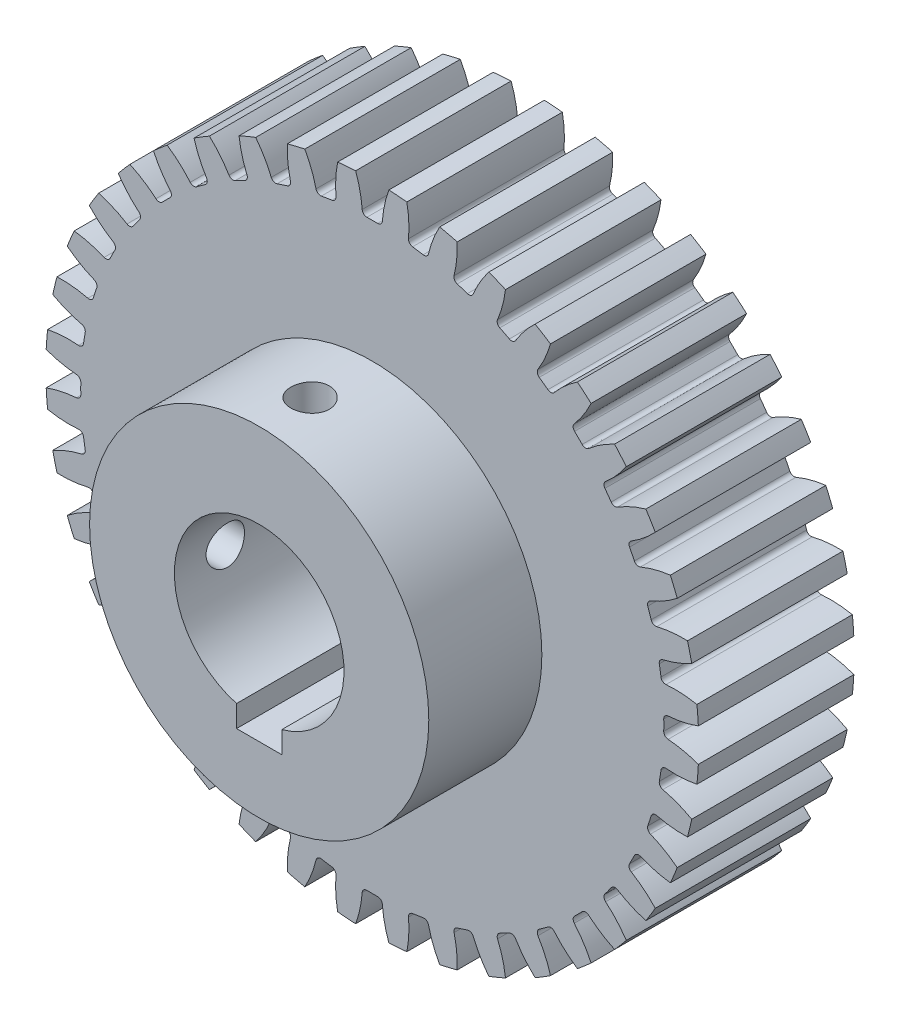
from build123d import *

# Parameters (mm, degrees)
SKETCH1_R                = 57.75
BOSS_EXTRUDE1_DEPTH      = 13.75
CUT_EXTRUDE1_DEPTH       = 27.5
FILLET1_R                = 0.825
CIRPATTERN1_COUNT        = 40
FILLET1_OF_CIRPATTERN1_R = 0.825
SKETCH3_R                = 30
BOSS_EXTRUDE2_DEPTH      = 20
SKETCH4_R                = 15
CUT_EXTRUDE2_DEPTH       = 95.387950609
CIRPATTERN2_COUNT        = 2
CIRPATTERN2_ANGLE        = 90
SKETCH7_W                = 8
SKETCH7_H                = 47.5
CUT_EXTRUDE3_DEPTH       = 18.3


with BuildPart() as part:
    # Sketch1 → Boss-Extrude1 (new, symmetric)
    with BuildSketch(Plane.XY):
        Circle(SKETCH1_R)
    extrude(amount=BOSS_EXTRUDE1_DEPTH, both=True)

    # Sketch2 → Cut-Extrude1 (cut)
    with BuildSketch(Plane.XY.offset(13.75)):
        with BuildLine():
            ThreePointArc((1.742642839, 51.533043789), (0, 51.5625), (-1.742642839, 51.533043789))
            ThreePointArc((-1.742642839, 51.533043789), (-2.159289867, 54.957596993), (-3.164274513, 58.257773542))
            ThreePointArc((-3.164274513, 58.257773542), (0, 58.343644138), (3.164274513, 58.257773542))
            ThreePointArc((3.164274513, 58.257773542), (2.159289867, 54.957596993), (1.742642839, 51.533043789))
        make_face()
    cut_extrude1 = extrude(amount=-CUT_EXTRUDE1_DEPTH, mode=Mode.SUBTRACT)

    # Fillet1
    fillet1_edges = [part.edges().sort_by_distance(p)[0] for p in [
        (1.742642839, 51.533043789, 0),
        (-1.742642839, 51.533043789, 0),
    ]]
    fillet(fillet1_edges, radius=FILLET1_R)

    # CirPattern1: Cut-Extrude1 ×40 about axis
    cirpattern1_axis = Axis((0, 0, 13.75), (0, 0, 1))
    for i in range(1, CIRPATTERN1_COUNT):
        add(cut_extrude1.rotate(cirpattern1_axis, i * 360 / CIRPATTERN1_COUNT), mode=Mode.SUBTRACT)

    # Fillet1 of CirPattern1
    fillet1_of_cirpattern1_edges = [part.edges().sort_by_distance(p)[0] for p in [
        (-6.340356123, 51.171195906, 0),
        (-9.782732151, 50.625977106, 0),
        (-14.267234475, 49.549343353, 0),
        (-17.581938131, 48.472330848, 0),
        (-21.842806164, 46.707421521, 0),
        (-24.948218442, 45.125134934, 0),
        (-28.880535473, 42.715407958, 0),
        (-31.700190817, 40.666808436, 0),
        (-35.20713015, 37.671599287, 0),
        (-37.671599287, 35.20713015, 0),
        (-40.666808436, 31.700190817, 0),
        (-42.715407958, 28.880535473, 0),
        (-45.125134934, 24.948218442, 0),
        (-46.707421521, 21.842806164, 0),
        (-48.472330848, 17.581938131, 0),
        (-49.549343353, 14.267234475, 0),
        (-50.625977106, 9.782732151, 0),
        (-51.171195906, 6.340356123, 0),
        (-51.533043789, 1.742642839, 0),
        (-51.533043789, -1.742642839, 0),
        (-51.171195906, -6.340356123, 0),
        (-50.625977106, -9.782732151, 0),
        (-49.549343353, -14.267234475, 0),
        (-48.472330848, -17.581938131, 0),
        (-46.707421521, -21.842806164, 0),
        (-45.125134934, -24.948218442, 0),
        (-42.715407958, -28.880535473, 0),
        (-40.666808436, -31.700190817, 0),
        (-37.671599287, -35.20713015, 0),
        (-35.20713015, -37.671599287, 0),
        (-31.700190817, -40.666808436, 0),
        (-28.880535473, -42.715407958, 0),
        (-24.948218442, -45.125134934, 0),
        (-21.842806164, -46.707421521, 0),
        (-17.581938131, -48.472330848, 0),
        (-14.267234475, -49.549343353, 0),
        (-9.782732151, -50.625977106, 0),
        (-6.340356123, -51.171195906, 0),
        (-1.742642839, -51.533043789, 0),
        (1.742642839, -51.533043789, 0),
        (6.340356123, -51.171195906, 0),
        (9.782732151, -50.625977106, 0),
        (14.267234475, -49.549343353, 0),
        (17.581938131, -48.472330848, 0),
        (21.842806164, -46.707421521, 0),
        (24.948218442, -45.125134934, 0),
        (28.880535473, -42.715407958, 0),
        (31.700190817, -40.666808436, 0),
        (35.20713015, -37.671599287, 0),
        (37.671599287, -35.20713015, 0),
        (40.666808436, -31.700190817, 0),
        (42.715407958, -28.880535473, 0),
        (45.125134934, -24.948218442, 0),
        (46.707421521, -21.842806164, 0),
        (48.472330848, -17.581938131, 0),
        (49.549343353, -14.267234475, 0),
        (50.625977106, -9.782732151, 0),
        (51.171195906, -6.340356123, 0),
        (51.533043789, -1.742642839, 0),
        (51.533043789, 1.742642839, 0),
        (51.171195906, 6.340356123, 0),
        (50.625977106, 9.782732151, 0),
        (49.549343353, 14.267234475, 0),
        (48.472330848, 17.581938131, 0),
        (46.707421521, 21.842806164, 0),
        (45.125134934, 24.948218442, 0),
        (42.715407958, 28.880535473, 0),
        (40.666808436, 31.700190817, 0),
        (37.671599287, 35.20713015, 0),
        (35.20713015, 37.671599287, 0),
        (31.700190817, 40.666808436, 0),
        (28.880535473, 42.715407958, 0),
        (24.948218442, 45.125134934, 0),
        (21.842806164, 46.707421521, 0),
        (17.581938131, 48.472330848, 0),
        (14.267234475, 49.549343353, 0),
        (9.782732151, 50.625977106, 0),
        (6.340356123, 51.171195906, 0),
    ]]
    fillet(fillet1_of_cirpattern1_edges, radius=FILLET1_OF_CIRPATTERN1_R)

    # Sketch3 → Boss-Extrude2 (add)
    with BuildSketch(Plane.XY.offset(13.75)):
        Circle(SKETCH3_R)
    extrude(amount=BOSS_EXTRUDE2_DEPTH)

    # Sketch4 → Cut-Extrude2 (cut, through all)
    with BuildSketch(Plane.XY.offset(33.75)):
        Circle(SKETCH4_R)
    extrude(amount=-CUT_EXTRUDE2_DEPTH, mode=Mode.SUBTRACT)

    # Sketch6 → M8 Tapped Hole1 (revolve, cut)
    with BuildSketch(Plane(origin=(0, 30, 24.75), x_dir=(0, 0, 1), z_dir=(1, 0, 0))):
        Polygon((0, 0), (0, 24.292926105), (3.4, 22.25), (3.4, 0), align=None)
    m8_tapped_hole1 = revolve(axis=Axis((0, 36.35, 24.75), (0, -1, 0)), mode=Mode.SUBTRACT)

    # CirPattern2: M8 Tapped Hole1 ×2 about axis
    cirpattern2_axis = Axis((0, 0, 33.75), (0, 0, 1))
    for i in range(1, CIRPATTERN2_COUNT):
        add(m8_tapped_hole1.rotate(cirpattern2_axis, i * CIRPATTERN2_ANGLE / (CIRPATTERN2_COUNT - 1)), mode=Mode.SUBTRACT)

    # Sketch7 → Cut-Extrude3 (cut)
    with BuildSketch(Plane(origin=(0, 0, 0), x_dir=(1, 0, 0), z_dir=(0, 1, 0))):
        with Locations((0, -10)):
            Rectangle(SKETCH7_W, SKETCH7_H)
    extrude(amount=-CUT_EXTRUDE3_DEPTH, mode=Mode.SUBTRACT)


solid = part.part
